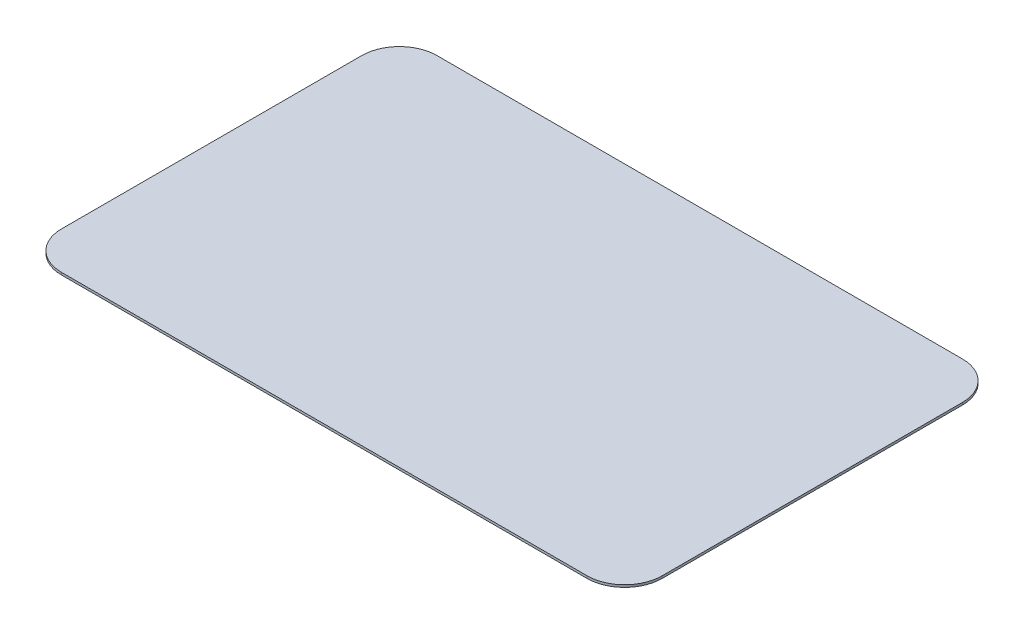
from build123d import *

# Parameters (mm, degrees)
MAINBODY_DEPTH = 0.79375


with BuildPart() as part:
    # Sketch1 → MainBody (new body)
    with BuildSketch(Plane(origin=(0, 25.019326354, 0), x_dir=(1, 0, 0), z_dir=(0, 1, 0))):
        with BuildLine():
            Line((98.380806561, -36.565564287), (98.380806561, 65.034435713))
            ThreePointArc((98.380806561, 65.034435713), (94.661062682, 74.014691834), (85.680806561, 77.734435713))
            Line((85.680806561, 77.734435713), (-92.119193439, 77.734435713))
            ThreePointArc((-92.119193439, 77.734435713), (-101.09944956, 74.014691834), (-104.819193439, 65.034435713))
            Line((-104.819193439, 65.034435713), (-104.819193439, -36.565564287))
            ThreePointArc((-104.819193439, -36.565564287), (-101.09944956, -45.545820408), (-92.119193439, -49.265564287))
            Line((-92.119193439, -49.265564287), (85.680806561, -49.265564287))
            ThreePointArc((85.680806561, -49.265564287), (94.661062682, -45.545820408), (98.380806561, -36.565564287))
        make_face()
    extrude(amount=MAINBODY_DEPTH)


solid = part.part
